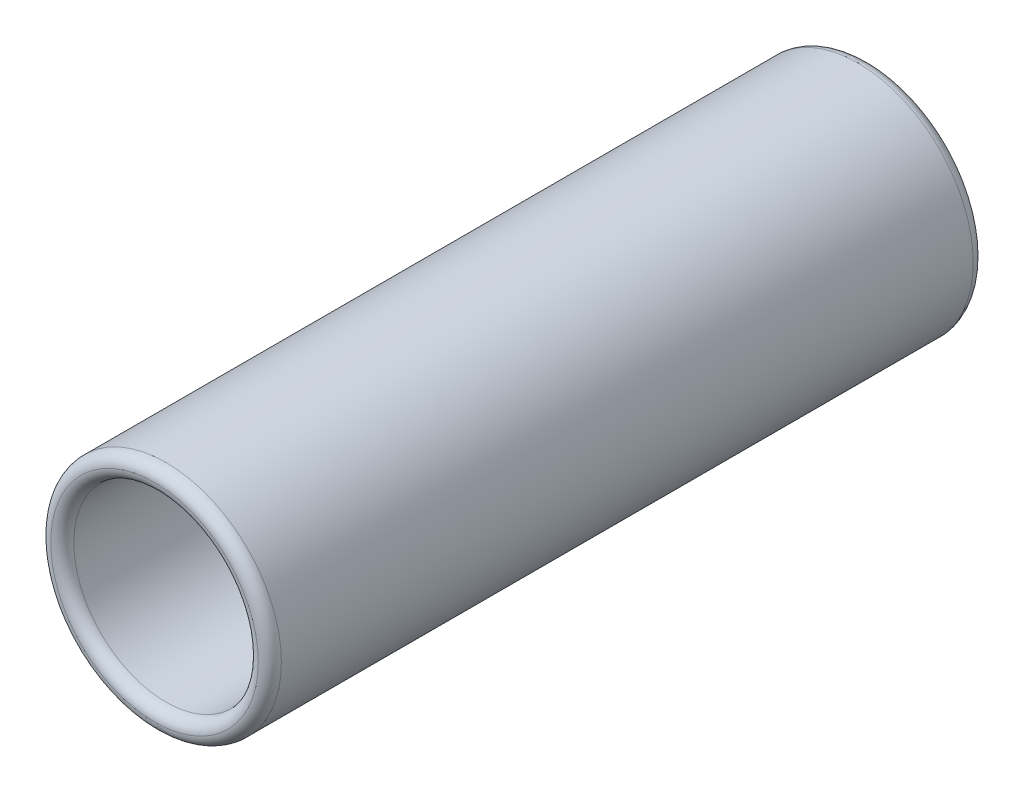
from build123d import *

# Parameters (mm, degrees)
SKETCH1_R           = 0.5
BOSS_EXTRUDE1_DEPTH = 3.1
SKETCH2_R           = 0.4
CUT_EXTRUDE1_DEPTH  = 3.1
FILLET1_R           = 0.05
FILLET2_R           = 0.05
FILLET3_R           = 0.05
FILLET4_R           = 0.05


with BuildPart() as part:
    # Sketch1 → Boss-Extrude1 (new body)
    with BuildSketch(Plane.XY):
        Circle(SKETCH1_R)
    extrude(amount=BOSS_EXTRUDE1_DEPTH)

    # Sketch2 → Cut-Extrude1 (cut)
    with BuildSketch(Plane.XY.offset(3.1)):
        Circle(SKETCH2_R)
    extrude(amount=-CUT_EXTRUDE1_DEPTH, mode=Mode.SUBTRACT)

    # Fillet1
    fillet1_edges = [part.edges().sort_by_distance(p)[0] for p in [
        (-0.5, 0, 3.1),
    ]]
    fillet(fillet1_edges, radius=FILLET1_R)

    # Fillet2
    fillet2_edges = [part.edges().sort_by_distance(p)[0] for p in [
        (-0.4, 0, 3.1),
    ]]
    fillet(fillet2_edges, radius=FILLET2_R - 0.0001)  # a hair under: the kernel refuses the full size

    # Fillet3
    fillet3_edges = [part.edges().sort_by_distance(p)[0] for p in [
        (-0.5, 0, 0),
    ]]
    fillet(fillet3_edges, radius=FILLET3_R)

    # Fillet4
    fillet4_edges = [part.edges().sort_by_distance(p)[0] for p in [
        (-0.4, 0, 0),
    ]]
    fillet(fillet4_edges, radius=FILLET4_R - 0.0001)  # a hair under: the kernel refuses the full size


solid = part.part
